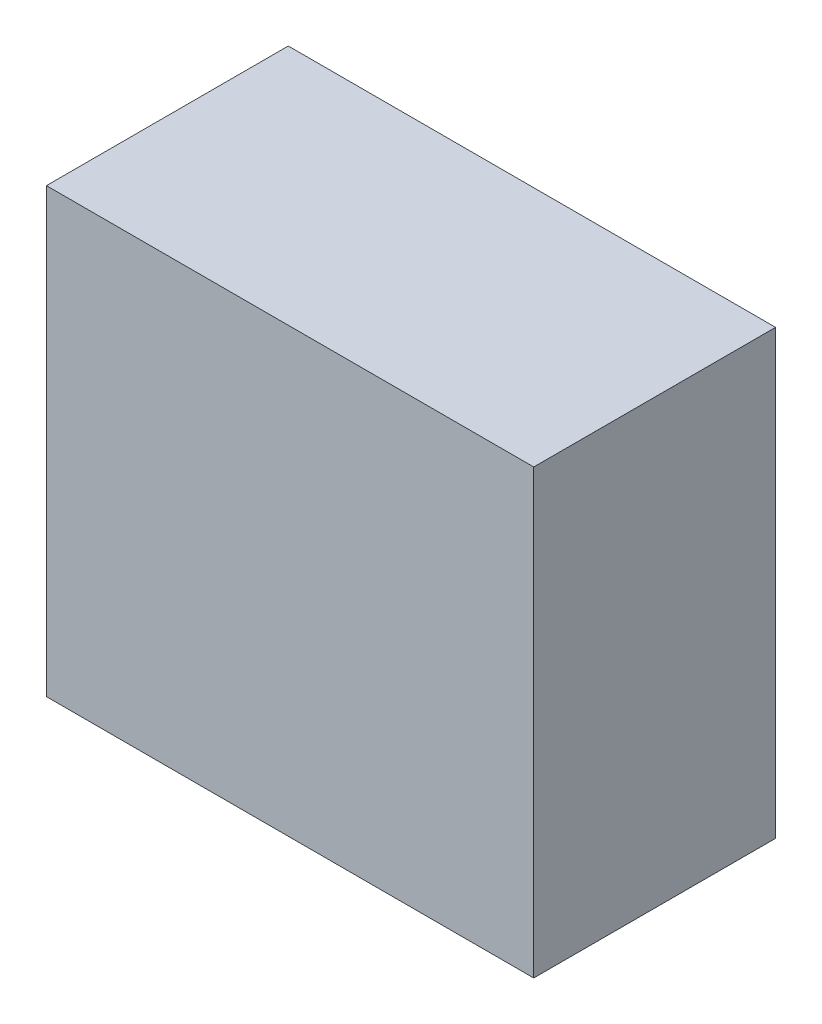
from build123d import *

# Parameters (mm, degrees)
SKETCH1_W           = 40.3
SKETCH1_H           = 20
BOSS_EXTRUDE1_DEPTH = 36.6


with BuildPart() as part:
    # Sketch1 → Boss-Extrude1 (new body)
    with BuildSketch(Plane(origin=(0, 0, 0), x_dir=(1, 0, 0), z_dir=(0, 1, 0))):
        Rectangle(SKETCH1_W, SKETCH1_H)
    extrude(amount=BOSS_EXTRUDE1_DEPTH)


solid = part.part
